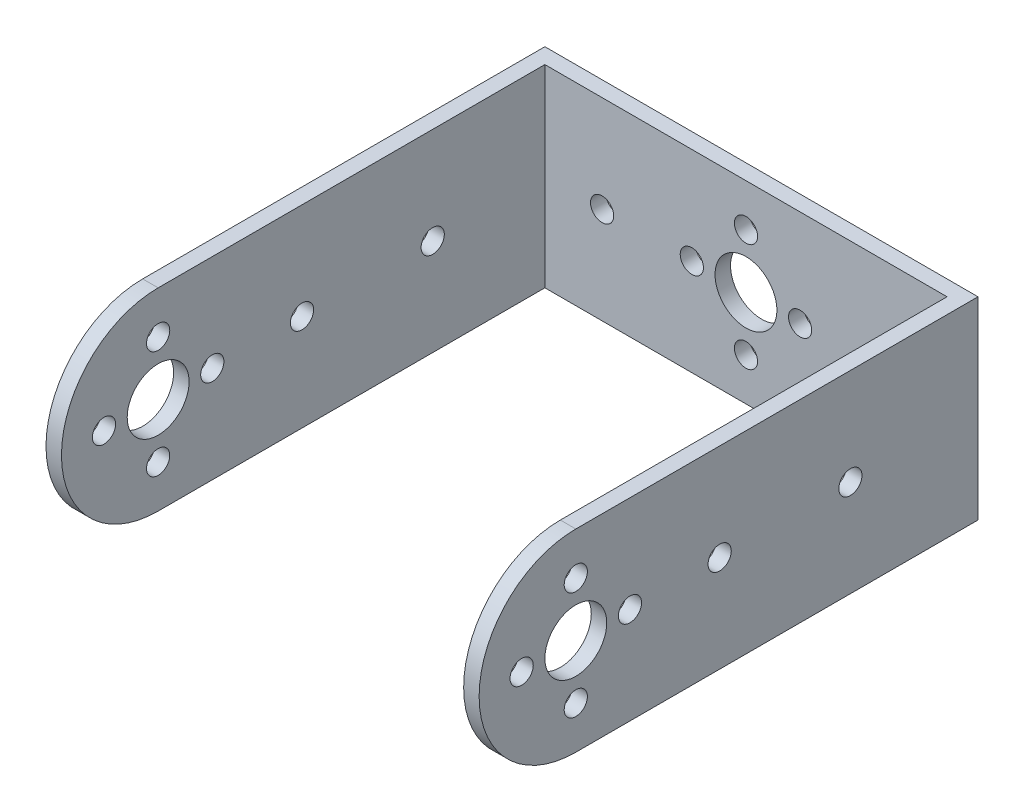
from build123d import *

# Parameters (mm, degrees)
SKETCH_1_W          = 56
SKETCH_1_H          = 25
EXTRUDE_1_DEPTH     = 64.5
CUT_EXTRUDE_1_DEPTH = 75.627407834
SKETCH_4_R          = 4
SKETCH_4_R_2        = 1.5
CUT_EXTRUDE_3_DEPTH = 70.616808315
CUT_EXTRUDE_4_DEPTH = 87.327863405
SKETCH_5_R          = 4
SKETCH_5_R_2        = 1.5
CUT_EXTRUDE_5_DEPTH = 87.327863405


with BuildPart() as part:
    # 草图1 → 凸台-拉伸1 (new body)
    with BuildSketch(Plane.XY):
        Rectangle(SKETCH_1_W, SKETCH_1_H)
    extrude(amount=EXTRUDE_1_DEPTH)

    # 草图2 → 切除-拉伸1 (cut, through all)
    with BuildSketch(Plane.XZ.offset(12.5)):
        Polygon((0, 64.5), (26, 64.5), (26, 2), (-26, 2), (-26, 64.5), align=None)
    extrude(amount=-CUT_EXTRUDE_1_DEPTH, mode=Mode.SUBTRACT)

    # 草图4 → 切除-拉伸3 (cut, through all)
    with BuildSketch(Plane.XY.offset(2)):
        Circle(SKETCH_4_R)
        with Locations((0, 7)):
            Circle(SKETCH_4_R_2)
        with Locations((0, -7)):
            Circle(SKETCH_4_R_2)
        with Locations((-7, 0)):
            Circle(SKETCH_4_R_2)
        with Locations((7, 0)):
            Circle(SKETCH_4_R_2)
        with Locations((18.6, 0)):
            Circle(SKETCH_4_R_2)
        with Locations((-18.6, 0)):
            Circle(SKETCH_4_R_2)
    extrude(amount=-CUT_EXTRUDE_3_DEPTH, mode=Mode.SUBTRACT)

    # 草图3 → 切除-拉伸4 (cut, through all)
    with BuildSketch(Plane(origin=(28, 0, 0), x_dir=(0, 0, -1), z_dir=(1, 0, 0))):
        with BuildLine():
            ThreePointArc((-64.5, 0), (-60.838834765, 8.838834765), (-52, 12.5))
            Line((-52, 12.5), (-64.5, 12.5))
            Line((-64.5, 12.5), (-64.5, 0))
        make_face()
        with BuildLine():
            ThreePointArc((-52, -12.5), (-60.838834765, -8.838834765), (-64.5, 0))
            Line((-64.5, 0), (-64.5, -12.5))
            Line((-64.5, -12.5), (-52, -12.5))
        make_face()
    extrude(amount=-CUT_EXTRUDE_4_DEPTH, mode=Mode.SUBTRACT)

    # 草图5 → 切除-拉伸5 (cut, through all)
    with BuildSketch(Plane(origin=(28, 0, 0), x_dir=(0, 0, -1), z_dir=(1, 0, 0))):
        with Locations((-52, 0)):
            Circle(SKETCH_5_R)
        with Locations((-52, 7)):
            Circle(SKETCH_5_R_2)
        with Locations((-59, 0)):
            Circle(SKETCH_5_R_2)
        with Locations((-52, -7)):
            Circle(SKETCH_5_R_2)
        with Locations((-45, 0)):
            Circle(SKETCH_5_R_2)
        with Locations((-33.4, 0)):
            Circle(SKETCH_5_R_2)
        with Locations((-16.5, 0)):
            Circle(SKETCH_5_R_2)
    extrude(amount=-CUT_EXTRUDE_5_DEPTH, mode=Mode.SUBTRACT)


solid = part.part
